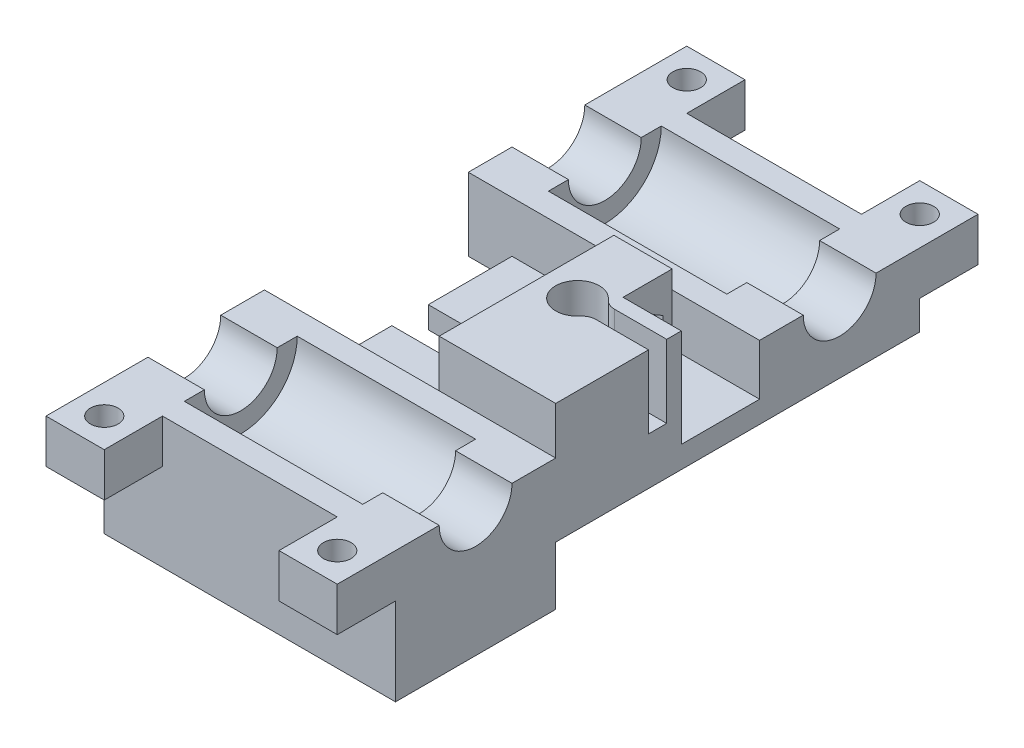
from build123d import *

# Parameters (mm, degrees)
SKETCH1_W                  = 40
SKETCH1_H                  = 22
BOSS_EXTRUDE1_DEPTH        = 11
SKETCH2_W                  = 40
SKETCH2_H                  = 22
SKETCH2_R                  = 4
BOSS_EXTRUDE2_DEPTH        = 7
SKETCH3_W                  = 24.5
SKETCH3_H                  = 15.5
CUT_EXTRUDE1_DEPTH         = 7.75
FILLET1_R                  = 7.75
SKETCH4_R                  = 5
CUT_EXTRUDE2_DEPTH         = 36.805900352
SKETCH5_W                  = 8
SKETCH5_H                  = 8
SKETCH5_R                  = 1.905800151
BOSS_EXTRUDE3_DEPTH        = 6
CUT_EXTRUDE3_START         = -3
SKETCH6_R                  = 3
SKETCH6_R_2                = 1.905800151
CUT_EXTRUDE3_DEPTH         = 3
SKETCH7_W                  = 16
SKETCH7_H                  = 16.5
BOSS_EXTRUDE5_DEPTH        = 28
MIRROR14_COPY_1_SKETCH_W   = 8
MIRROR14_COPY_1_SKETCH_H   = 8
MIRROR14_COPY_1_SKETCH_R   = 1.905800151
MIRROR14_COPY_1_DEPTH      = 6
MIRROR14_START             = -3
MIRROR14_COPY_2_SKETCH_R   = 3
MIRROR14_COPY_2_SKETCH_R_2 = 1.905800151
MIRROR14_COPY_2_DEPTH      = 3
FILLET1_OF_MIRROR14_R      = 7.75
SKETCH9_W                  = 28
SKETCH9_H                  = 3
BOSS_EXTRUDE6_DEPTH        = 18
CUT_EXTRUDE4_DEPTH         = 10
CUT_EXTRUDE5_DEPTH         = 74.288812243
CUT_EXTRUDE5_DEPTH_BACK    = 74.288812243
SKETCH11_R                 = 1.75
CUT_EXTRUDE6_DEPTH         = 76.121568141
CUT_EXTRUDE6_DEPTH_BACK    = 76.121568141
SKETCH12_R                 = 1.75
FILLET2_R                  = 2
CUT_EXTRUDE12_START        = -3
SKETCH17_R                 = 1.75
CUT_EXTRUDE12_DEPTH        = 3
CUT_EXTRUDE13_DEPTH        = 74.097537578
CUT_EXTRUDE13_DEPTH_BACK   = 74.097537578
SKETCH18_W                 = 18
SKETCH18_H                 = 5
FILLET3_R                  = 2.5
CUT_EXTRUDE14_DEPTH        = 74.710582687
CUT_EXTRUDE15_START        = -10
SKETCH21_R                 = 1.75
CUT_EXTRUDE15_DEPTH        = 10
SKETCH20_W                 = 36.163748027
SKETCH20_H                 = 4
CUT_EXTRUDE16_DEPTH        = 13.5
SKETCH22_W                 = 6.75
SKETCH22_H                 = 13.5
CUT_EXTRUDE18_DEPTH        = 8
SKETCH23_R                 = 4
BOSS_EXTRUDE8_DEPTH        = 1


with BuildPart() as part:
    # Sketch1 → Boss-Extrude1 (new body)
    with BuildSketch(Plane(origin=(0, 0, 0), x_dir=(1, 0, 0), z_dir=(0, 1, 0))):
        Rectangle(SKETCH1_W, SKETCH1_H)
    boss_extrude1 = extrude(amount=BOSS_EXTRUDE1_DEPTH)

    # Sketch2 → Boss-Extrude2 (add)
    with BuildSketch(Plane(origin=(0, 0, 0), x_dir=(1, 0, 0), z_dir=(0, 1, 0))):
        Rectangle(SKETCH2_W, SKETCH2_H)
        with Locations(Location((0, 0, 0), (0, 0, 270))):
            Circle(SKETCH2_R, mode=Mode.SUBTRACT)
    boss_extrude2 = extrude(amount=-BOSS_EXTRUDE2_DEPTH)

    # Sketch3 → Cut-Extrude1 (cut)
    with BuildSketch(Plane(origin=(0, 11, 0), x_dir=(1, 0, 0), z_dir=(0, 1, 0))):
        Rectangle(SKETCH3_W, SKETCH3_H)
    cut_extrude1 = extrude(amount=-CUT_EXTRUDE1_DEPTH, mode=Mode.SUBTRACT)

    # Fillet1
    fillet1_edges = [part.edges().sort_by_distance(p)[0] for p in [
        (0, 3.25, 7.75),
        (0, 3.25, -7.75),
    ]]
    fillet(fillet1_edges, radius=FILLET1_R - 0.0001)  # a hair under: the kernel refuses the full size

    # Sketch4 → Cut-Extrude2 (cut, symmetric)
    with BuildSketch(Plane(origin=(-12.25, 0, 0), x_dir=(0, 0, -1), z_dir=(1, 0, 0))):
        with Locations((0, 11)):
            Circle(SKETCH4_R)
    cut_extrude2 = extrude(amount=CUT_EXTRUDE2_DEPTH, both=True, mode=Mode.SUBTRACT)

    # Sketch5 → Boss-Extrude3 (add)
    with BuildSketch(Plane(origin=(0, 11, 0), x_dir=(1, 0, 0), z_dir=(0, 1, 0))):
        with Locations((16, -15)):
            Rectangle(SKETCH5_W, SKETCH5_H)
        with Locations(Location((16, -15, 0), (0, 0, 270))):
            Circle(SKETCH5_R, mode=Mode.SUBTRACT)
    boss_extrude3 = extrude(amount=-BOSS_EXTRUDE3_DEPTH)

    # Sketch6 → Cut-Extrude3 (cut)
    with BuildSketch(Plane.XZ.offset(-5).offset(CUT_EXTRUDE3_START)):
        with Locations(Location((16, 15, 0), (0, 0, 270))):
            Circle(SKETCH6_R)
        with Locations(Location((16, 15, 0), (0, 0, 90))):
            Circle(SKETCH6_R_2, mode=Mode.SUBTRACT)
    cut_extrude3 = extrude(amount=CUT_EXTRUDE3_DEPTH, mode=Mode.SUBTRACT)

    # Mirror8: Boss-Extrude3, Cut-Extrude3 across plane
    add(boss_extrude3.mirror(Plane(origin=(0, 0, 0), x_dir=(0, 0, 1), z_dir=(1, 0, 0))))
    add(cut_extrude3.mirror(Plane(origin=(0, 0, 0), x_dir=(0, 0, 1), z_dir=(1, 0, 0))), mode=Mode.SUBTRACT)

    # Sketch7 → Boss-Extrude5 (add)
    with BuildSketch(Plane(origin=(0, 0, -11), x_dir=(-1, 0, 0), z_dir=(0, 0, -1))):
        with Locations((-12, 9.25)):
            Rectangle(SKETCH7_W, SKETCH7_H)
    extrude(amount=BOSS_EXTRUDE5_DEPTH)

    # Mirror14: Boss-Extrude1, Boss-Extrude2, Cut-Extrude1, Cut-Extrude2, Boss-Extrude3, Cut-Extrude3 across plane
    add(boss_extrude1.mirror(Plane.XY.offset(-25)))
    add(boss_extrude2.mirror(Plane.XY.offset(-25)))
    add(cut_extrude1.mirror(Plane.XY.offset(-25)), mode=Mode.SUBTRACT)
    add(cut_extrude2.mirror(Plane.XY.offset(-25)), mode=Mode.SUBTRACT)
    add(boss_extrude3.mirror(Plane.XY.offset(-25)))
    add(cut_extrude3.mirror(Plane.XY.offset(-25)), mode=Mode.SUBTRACT)

    # Mirror14 copy 1 sketch → Mirror14 copy 1 (add)
    with BuildSketch(Plane(origin=(0, 11, -50), x_dir=(-1, 0, 0), z_dir=(0, 1, 0))):
        with Locations((16, -15)):
            Rectangle(MIRROR14_COPY_1_SKETCH_W, MIRROR14_COPY_1_SKETCH_H)
        with Locations(Location((16, -15, 0), (0, 0, 270))):
            Circle(MIRROR14_COPY_1_SKETCH_R, mode=Mode.SUBTRACT)
    extrude(amount=-MIRROR14_COPY_1_DEPTH)

    # Mirror14 copy 2 sketch → Mirror14 copy 2 (cut)
    with BuildSketch(Plane(origin=(0, 5, -50), x_dir=(-1, 0, 0), z_dir=(0, -1, 0)).offset(MIRROR14_START)):
        with Locations(Location((16, 15, 0), (0, 0, 270))):
            Circle(MIRROR14_COPY_2_SKETCH_R)
        with Locations(Location((16, 15, 0), (0, 0, 90))):
            Circle(MIRROR14_COPY_2_SKETCH_R_2, mode=Mode.SUBTRACT)
    extrude(amount=MIRROR14_COPY_2_DEPTH, mode=Mode.SUBTRACT)

    # Fillet1 of Mirror14
    fillet1_of_mirror14_edges = [part.edges().sort_by_distance(p)[0] for p in [
        (0, 3.25, -57.75),
        (0, 3.25, -42.25),
    ]]
    fillet(fillet1_of_mirror14_edges, radius=FILLET1_OF_MIRROR14_R - 0.0001)  # a hair under: the kernel refuses the full size

    # Sketch9 → Boss-Extrude6 (add)
    with BuildSketch(Plane.ZY.offset(-4)):
        with Locations((-25, 2.5)):
            Rectangle(SKETCH9_W, SKETCH9_H)
    extrude(amount=BOSS_EXTRUDE6_DEPTH)

    # Sketch10 → Cut-Extrude4 (cut)
    with BuildSketch(Plane(origin=(0, 17.5, 0), x_dir=(1, 0, 0), z_dir=(0, 1, 0))):
        with BuildLine():
            Line((9, 26.25), (9, 23.75))
            Line((9, 23.75), (11.727178029, 23.75))
            ThreePointArc((11.727178029, 23.75), (11.931001031, 24.360286817), (12, 25))
            ThreePointArc((12, 25), (11.931001031, 25.639713183), (11.727178029, 26.25))
            Line((11.727178029, 26.25), (9, 26.25))
        make_face()
        with BuildLine():
            Line((11.727178029, 23.75), (9, 23.75))
            Line((9, 23.75), (9, 26.25))
            Line((9, 26.25), (11.727178029, 26.25))
            ThreePointArc((11.727178029, 26.25), (6, 25), (11.727178029, 23.75))
        make_face()
        with BuildLine():
            ThreePointArc((12, 25), (11.931001031, 24.360286817), (11.727178029, 23.75))
            Line((11.727178029, 23.75), (20, 23.75))
            Line((20, 23.75), (20, 26.25))
            Line((20, 26.25), (11.727178029, 26.25))
            ThreePointArc((11.727178029, 26.25), (11.931001031, 25.639713183), (12, 25))
        make_face()
    extrude(amount=-CUT_EXTRUDE4_DEPTH, mode=Mode.SUBTRACT)

    # Sketch11 → Cut-Extrude5 (cut, two sides: drawn at the far end of the back side and taken through both)
    with BuildSketch(Plane(origin=(0, 7.5, 0), x_dir=(1, 0, 0), z_dir=(0, 1, 0)).offset(-CUT_EXTRUDE5_DEPTH_BACK)):
        with Locations(Location((9, 25, 0), (0, 0, 270))):
            Circle(SKETCH11_R)
    extrude(amount=CUT_EXTRUDE5_DEPTH + CUT_EXTRUDE5_DEPTH_BACK, mode=Mode.SUBTRACT)

    # Sketch12 → Cut-Extrude6 (cut, two sides: drawn at the far end of the back side and taken through both)
    with BuildSketch(Plane.ZY.offset(-4).offset(-CUT_EXTRUDE6_DEPTH_BACK)):
        with Locations((-31, 11)):
            Circle(SKETCH12_R)
    extrude(amount=CUT_EXTRUDE6_DEPTH + CUT_EXTRUDE6_DEPTH_BACK, mode=Mode.SUBTRACT)

    # Fillet2
    fillet2_edges = [part.edges().sort_by_distance(p)[0] for p in [
        (11.727178029, 12.5, -23.75),
        (11.727178029, 12.5, -26.25),
    ]]
    fillet(fillet2_edges, radius=FILLET2_R)

    # Sketch17 → Cut-Extrude12 (cut)
    with BuildSketch(Plane.XZ.offset(-1).offset(CUT_EXTRUDE12_START)):
        Polygon((12.175426481, -25), (10.58771324, -22.25), (7.41228676, -22.25), (5.824573519, -25), (7.41228676, -27.75), (10.58771324, -27.75), align=None)
        with Locations(Location((9, -25, 0), (0, 0, 90))):
            Circle(SKETCH17_R, mode=Mode.SUBTRACT)
    extrude(amount=CUT_EXTRUDE12_DEPTH, mode=Mode.SUBTRACT)

    # Sketch18 → Cut-Extrude13 (cut, two sides: drawn at the far end of the back side and taken through both)
    with BuildSketch(Plane(origin=(0, 4, 0), x_dir=(1, 0, 0), z_dir=(0, 1, 0)).offset(-CUT_EXTRUDE13_DEPTH_BACK)):
        with Locations((-5, 25)):
            Rectangle(SKETCH18_W, SKETCH18_H)
    extrude(amount=CUT_EXTRUDE13_DEPTH + CUT_EXTRUDE13_DEPTH_BACK, mode=Mode.SUBTRACT)

    # Fillet3
    fillet3_edges = [part.edges().sort_by_distance(p)[0] for p in [
        (4, 2.5, -27.5),
        (4, 2.5, -22.5),
    ]]
    fillet(fillet3_edges, radius=FILLET3_R - 0.0001)  # a hair under: the kernel refuses the full size

    # Sketch19 → Cut-Extrude14 (cut, through all)
    with BuildSketch(Plane.XZ.offset(-1)):
        Polygon((20, -61), (20, -39), (-14, -39), (-20, -39), (-20, -61), align=None)
    extrude(amount=CUT_EXTRUDE14_DEPTH, mode=Mode.SUBTRACT)

    # Sketch21 → Cut-Extrude15 (cut)
    with BuildSketch(Plane(origin=(20, 0, 0), x_dir=(0, 0, -1), z_dir=(1, 0, 0)).offset(CUT_EXTRUDE15_START)):
        Polygon((31, 14.175426481), (28.25, 12.58771324), (28.25, 9.41228676), (31, 7.824573519), (33.75, 9.41228676), (33.75, 12.58771324), align=None)
        with Locations((31, 11)):
            Circle(SKETCH21_R, mode=Mode.SUBTRACT)
    extrude(amount=CUT_EXTRUDE15_DEPTH, mode=Mode.SUBTRACT)

    # Sketch20 → Cut-Extrude16 (cut)
    with BuildSketch(Plane(origin=(0, 17.5, 0), x_dir=(1, 0, 0), z_dir=(0, 1, 0))):
        with Locations((22.081874014, 37)):
            Rectangle(SKETCH20_W, SKETCH20_H)
    extrude(amount=-CUT_EXTRUDE16_DEPTH, mode=Mode.SUBTRACT)

    # Sketch22 → Cut-Extrude18 (cut)
    with BuildSketch(Plane(origin=(20, 0, 0), x_dir=(0, 0, -1), z_dir=(1, 0, 0))):
        with Locations((31.625, 10.75)):
            Rectangle(SKETCH22_W, SKETCH22_H)
    extrude(amount=-CUT_EXTRUDE18_DEPTH, mode=Mode.SUBTRACT)

    # Sketch23 → Boss-Extrude8 (add)
    with BuildSketch(Plane.XZ):
        with Locations(Location((0, 0, 0), (0, 0, 90))):
            Circle(SKETCH23_R)
    extrude(amount=BOSS_EXTRUDE8_DEPTH)


solid = part.part
